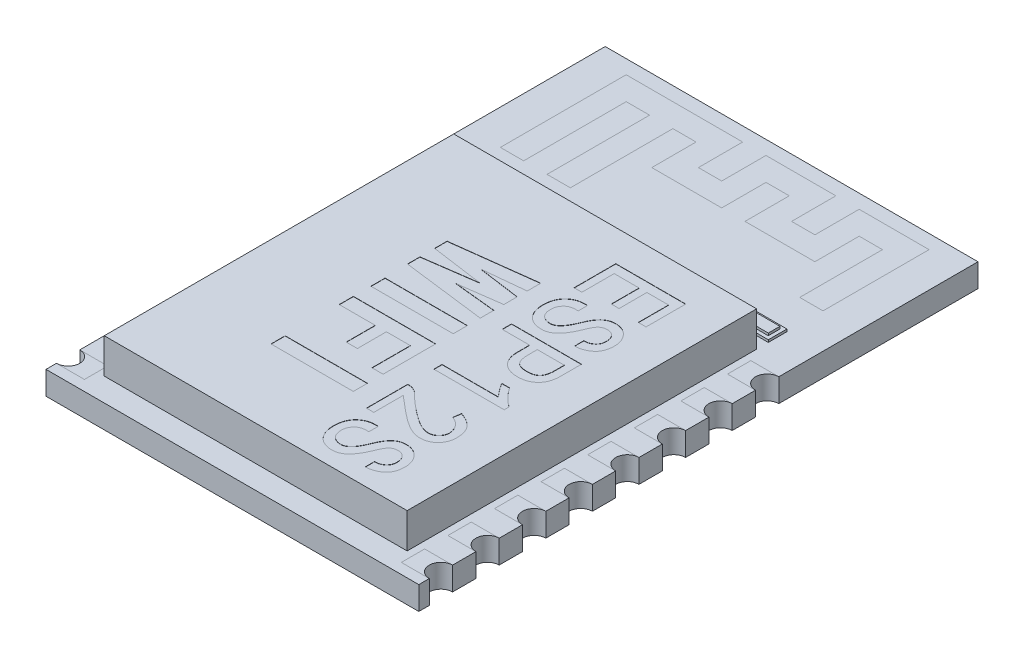
from build123d import *

# Parameters (mm, degrees)
SKETCH_1_W                = 16
SKETCH_1_H                = 24
EXTRUDE_1_DEPTH           = 1
SKETCH_2_W                = 13
SKETCH_2_H                = 15
EXTRUDE_2_DEPTH           = 1.5
CUT_EXTRUDE_1_DEPTH       = 1
SKETCH_9_W                = 1.6
SKETCH_9_H                = 0.8
EXTRUDE_3_DEPTH           = 0.1
SKETCH_10_W               = 1.3
SKETCH_10_H               = 0.5
EXTRUDE_4_DEPTH           = 0.1
CUT_EXTRUDE_START         = -0.01
CUT_EXTRUDE_2_OUTLINE_W   = 3.531838856
CUT_EXTRUDE_2_OUTLINE_H   = 0.607212475
CUT_EXTRUDE_2_OUTLINE_H_2 = 0.607212476
CUT_EXTRUDE_2_DEPTH       = 0.01
SKETCH_8_W                = 3.2
SKETCH_8_H                = 3.2
CUT_EXTRUDE_5_DEPTH       = 0.01


# Read off the part's stored shape, not the designer's step: 切除-拉伸2
with BuildPart() as part:
    # 草图1 → 凸台-拉伸1 (new body)
    with BuildSketch(Plane(origin=(0, 0, 0), x_dir=(1, 0, 0), z_dir=(0, 1, 0))):
        Rectangle(SKETCH_1_W, SKETCH_1_H)
    extrude(amount=EXTRUDE_1_DEPTH)

    # 草图2 → 凸台-拉伸2 (add)
    with BuildSketch(Plane(origin=(0, 1, 0), x_dir=(1, 0, 0), z_dir=(0, 1, 0))):
        with Locations((0, -3.5)):
            Rectangle(SKETCH_2_W, SKETCH_2_H)
    extrude(amount=EXTRUDE_2_DEPTH)

    # 草图3 → 切除-拉伸1 (cut)
    with BuildSketch(Plane(origin=(0, 1, 0), x_dir=(1, 0, 0), z_dir=(0, 1, 0))):
        with BuildLine():
            ThreePointArc((-8, 3.45), (-8.5, 2.95), (-8, 2.45))
            Line((-8, 2.45), (-8, 3.45))
        make_face()
        with BuildLine():
            Line((-8, 3.45), (-8, 2.45))
            ThreePointArc((-8, 2.45), (-7.646446609, 2.596446609), (-7.5, 2.95))
            ThreePointArc((-7.5, 2.95), (-7.646446609, 3.303553391), (-8, 3.45))
        make_face()
        with BuildLine():
            ThreePointArc((-8, 1.45), (-8.5, 0.95), (-8, 0.45))
            Line((-8, 0.45), (-8, 1.45))
        make_face()
        with BuildLine():
            Line((-8, 1.45), (-8, 0.45))
            ThreePointArc((-8, 0.45), (-7.646446609, 0.596446609), (-7.5, 0.95))
            ThreePointArc((-7.5, 0.95), (-7.646446609, 1.303553391), (-8, 1.45))
        make_face()
        with BuildLine():
            ThreePointArc((-8, -0.55), (-8.5, -1.05), (-8, -1.55))
            Line((-8, -1.55), (-8, -0.55))
        make_face()
        with BuildLine():
            Line((-8, -0.55), (-8, -1.55))
            ThreePointArc((-8, -1.55), (-7.646446609, -1.403553391), (-7.5, -1.05))
            ThreePointArc((-7.5, -1.05), (-7.646446609, -0.696446609), (-8, -0.55))
        make_face()
        with BuildLine():
            ThreePointArc((-8, -2.55), (-8.5, -3.05), (-8, -3.55))
            Line((-8, -3.55), (-8, -2.55))
        make_face()
        with BuildLine():
            Line((-8, -2.55), (-8, -3.55))
            ThreePointArc((-8, -3.55), (-7.646446609, -3.403553391), (-7.5, -3.05))
            ThreePointArc((-7.5, -3.05), (-7.646446609, -2.696446609), (-8, -2.55))
        make_face()
        with BuildLine():
            ThreePointArc((-8, -4.55), (-8.5, -5.05), (-8, -5.55))
            Line((-8, -5.55), (-8, -4.55))
        make_face()
        with BuildLine():
            Line((-8, -4.55), (-8, -5.55))
            ThreePointArc((-8, -5.55), (-7.646446609, -5.403553391), (-7.5, -5.05))
            ThreePointArc((-7.5, -5.05), (-7.646446609, -4.696446609), (-8, -4.55))
        make_face()
        with BuildLine():
            ThreePointArc((-8, -6.55), (-8.5, -7.05), (-8, -7.55))
            Line((-8, -7.55), (-8, -6.55))
        make_face()
        with BuildLine():
            Line((-8, -6.55), (-8, -7.55))
            ThreePointArc((-8, -7.55), (-7.646446609, -7.403553391), (-7.5, -7.05))
            ThreePointArc((-7.5, -7.05), (-7.646446609, -6.696446609), (-8, -6.55))
        make_face()
        with BuildLine():
            ThreePointArc((-8, -8.55), (-8.5, -9.05), (-8, -9.55))
            Line((-8, -9.55), (-8, -8.55))
        make_face()
        with BuildLine():
            Line((-8, -8.55), (-8, -9.55))
            ThreePointArc((-8, -9.55), (-7.646446609, -9.403553391), (-7.5, -9.05))
            ThreePointArc((-7.5, -9.05), (-7.646446609, -8.696446609), (-8, -8.55))
        make_face()
        with BuildLine():
            Line((-8, -10.55), (-8, -11.55))
            ThreePointArc((-8, -11.55), (-7.646446609, -11.403553391), (-7.5, -11.05))
            ThreePointArc((-7.5, -11.05), (-7.646446609, -10.696446609), (-8, -10.55))
        make_face()
        with BuildLine():
            ThreePointArc((-8, -10.55), (-8.5, -11.05), (-8, -11.55))
            Line((-8, -11.55), (-8, -10.55))
        make_face()
        with BuildLine():
            Line((8, -10.55), (8, -11.55))
            ThreePointArc((8, -11.55), (8.353553391, -11.403553391), (8.5, -11.05))
            ThreePointArc((8.5, -11.05), (8.353553391, -10.696446609), (8, -10.55))
        make_face()
        with BuildLine():
            ThreePointArc((8, -10.55), (7.5, -11.05), (8, -11.55))
            Line((8, -11.55), (8, -10.55))
        make_face()
        with BuildLine():
            ThreePointArc((8, -8.55), (7.5, -9.05), (8, -9.55))
            Line((8, -9.55), (8, -8.55))
        make_face()
        with BuildLine():
            Line((8, -8.55), (8, -9.55))
            ThreePointArc((8, -9.55), (8.353553391, -9.403553391), (8.5, -9.05))
            ThreePointArc((8.5, -9.05), (8.353553391, -8.696446609), (8, -8.55))
        make_face()
        with BuildLine():
            ThreePointArc((8, -6.55), (7.5, -7.05), (8, -7.55))
            Line((8, -7.55), (8, -6.55))
        make_face()
        with BuildLine():
            Line((8, -6.55), (8, -7.55))
            ThreePointArc((8, -7.55), (8.353553391, -7.403553391), (8.5, -7.05))
            ThreePointArc((8.5, -7.05), (8.353553391, -6.696446609), (8, -6.55))
        make_face()
        with BuildLine():
            ThreePointArc((8, -4.55), (7.5, -5.05), (8, -5.55))
            Line((8, -5.55), (8, -4.55))
        make_face()
        with BuildLine():
            Line((8, -4.55), (8, -5.55))
            ThreePointArc((8, -5.55), (8.353553391, -5.403553391), (8.5, -5.05))
            ThreePointArc((8.5, -5.05), (8.353553391, -4.696446609), (8, -4.55))
        make_face()
        with BuildLine():
            ThreePointArc((8, -2.55), (7.5, -3.05), (8, -3.55))
            Line((8, -3.55), (8, -2.55))
        make_face()
        with BuildLine():
            Line((8, -2.55), (8, -3.55))
            ThreePointArc((8, -3.55), (8.353553391, -3.403553391), (8.5, -3.05))
            ThreePointArc((8.5, -3.05), (8.353553391, -2.696446609), (8, -2.55))
        make_face()
        with BuildLine():
            ThreePointArc((8, -0.55), (7.5, -1.05), (8, -1.55))
            Line((8, -1.55), (8, -0.55))
        make_face()
        with BuildLine():
            Line((8, -0.55), (8, -1.55))
            ThreePointArc((8, -1.55), (8.353553391, -1.403553391), (8.5, -1.05))
            ThreePointArc((8.5, -1.05), (8.353553391, -0.696446609), (8, -0.55))
        make_face()
        with BuildLine():
            ThreePointArc((8, 1.45), (7.5, 0.95), (8, 0.45))
            Line((8, 0.45), (8, 1.45))
        make_face()
        with BuildLine():
            Line((8, 1.45), (8, 0.45))
            ThreePointArc((8, 0.45), (8.353553391, 0.596446609), (8.5, 0.95))
            ThreePointArc((8.5, 0.95), (8.353553391, 1.303553391), (8, 1.45))
        make_face()
        with BuildLine():
            ThreePointArc((8, 3.45), (7.5, 2.95), (8, 2.45))
            Line((8, 2.45), (8, 3.45))
        make_face()
        with BuildLine():
            Line((8, 3.45), (8, 2.45))
            ThreePointArc((8, 2.45), (8.353553391, 2.596446609), (8.5, 2.95))
            ThreePointArc((8.5, 2.95), (8.353553391, 3.303553391), (8, 3.45))
        make_face()
    extrude(amount=-CUT_EXTRUDE_1_DEPTH, mode=Mode.SUBTRACT)

    # 草图9 → 凸台-拉伸3 (add)
    with BuildSketch(Plane(origin=(0, 1, 0), x_dir=(1, 0, 0), z_dir=(0, 1, 0))):
        with Locations((5.7, 4.9)):
            Rectangle(SKETCH_9_W, SKETCH_9_H)
    extrude(amount=EXTRUDE_3_DEPTH)

    # 草图10 → 凸台-拉伸4 (add)
    with BuildSketch(Plane(origin=(0, 1.1, 0), x_dir=(1, 0, 0), z_dir=(0, 1, 0))):
        with Locations((5.7, 4.9)):
            Rectangle(SKETCH_10_W, SKETCH_10_H)
    extrude(amount=EXTRUDE_4_DEPTH)

    # 切除-拉伸2 outline → 切除-拉伸2 (cut)
    # profile 1 of 10: a face of its own
    with BuildSketch(Plane(origin=(0, 2.5, 0), x_dir=(1, 0, 0), z_dir=(0, 1, 0)).offset(CUT_EXTRUDE_START)):
        with BuildLine():
            add(Edge.make_bspline(
                [(3.519363514, -0.573077613), (3.506180189, -0.604374603), (3.480321871, -0.665761813), (3.438065941, -0.754342565), (3.393477309, -0.837105399), (3.346888787, -0.914390898), (3.2992323, -0.986513696), (3.248925337, -1.052982289), (3.197137753, -1.114210667), (3.143128362, -1.169656382), (3.087327215, -1.218956612), (3.030085251, -1.262684809), (2.969712111, -1.298137991), (2.908286481, -1.328486201), (2.844280267, -1.351193456), (2.778932691, -1.368309054), (2.711135379, -1.378266097), (2.665377652, -1.379479666), (2.642170532, -1.380095157)],
                knots=[0, 0, 0, 0, 0.08039145, 0.157683112, 0.232246008, 0.302860745, 0.37126645, 0.436798221, 0.500091035, 0.561008802, 0.619858574, 0.676262796, 0.73122448, 0.785347374, 0.838224428, 0.891702223, 0.945074206, 1, 1, 1, 1], degree=3))
            add(Edge.make_bspline(
                [(4.063223163, 0.023413615), (4.037768104, 0.022396868), (3.987900685, 0.020405023), (3.915815291, 0.001507672), (3.849482488, -0.029464233), (3.798207898, -0.065289123), (3.758940458, -0.103370017), (3.729141298, -0.142889003), (3.697369984, -0.191127277), (3.664016743, -0.248762656), (3.630282743, -0.316438497), (3.59345619, -0.392965264), (3.556858097, -0.479816814), (3.53226566, -0.540985927), (3.519363514, -0.573077613)],
                knots=[0, 0, 0, 0, 0.087880545, 0.172161291, 0.255589258, 0.339949821, 0.387083158, 0.444162172, 0.51062919, 0.586800429, 0.674217052, 0.772034265, 0.880400347, 1, 1, 1, 1], degree=3))
            add(Edge.make_bspline(
                [(4.484275795, -0.432726736), (4.483074162, -0.399237078), (4.480783329, -0.335391269), (4.458815205, -0.245038996), (4.423046912, -0.165363803), (4.372345628, -0.097879575), (4.310256118, -0.042998439), (4.236663872, -0.00379167), (4.152959017, 0.019252706), (4.093911407, 0.02199065), (4.063223163, 0.023413615)],
                knots=[0, 0, 0, 0, 0.143194835, 0.272991443, 0.395421471, 0.51469472, 0.631696167, 0.747467017, 0.868753474, 1, 1, 1, 1], degree=3))
            add(Edge.make_bspline(
                [(3.975503865, -0.888867087), (4.006972911, -0.890134244), (4.069172678, -0.892638828), (4.161013939, -0.874188051), (4.247874476, -0.838045884), (4.314849624, -0.794580554), (4.363848147, -0.752220585), (4.395871079, -0.715982307), (4.423515368, -0.676950205), (4.445556411, -0.634167461), (4.463336103, -0.588509062), (4.475587773, -0.539393376), (4.482709858, -0.487084377), (4.483744786, -0.451159418), (4.484275795, -0.432726736)],
                knots=[0, 0, 0, 0, 0.121689023, 0.240522989, 0.35943694, 0.484440651, 0.548073235, 0.609892423, 0.671357409, 0.732919718, 0.795884691, 0.860815642, 0.928586112, 1, 1, 1, 1], degree=3))
            Line((3.975503865, -0.888867087), (3.975503865, -1.292375859))
            add(Edge.make_bspline(
                [(4.835152988, -0.432726736), (4.83420401, -0.469361543), (4.832362195, -0.540463843), (4.820373567, -0.643266294), (4.799042758, -0.738043744), (4.768938228, -0.824795289), (4.730848953, -0.903892889), (4.683510498, -0.974861907), (4.627867106, -1.037953658), (4.56384263, -1.092111052), (4.495270717, -1.13851103), (4.425466025, -1.180158489), (4.35386765, -1.214561079), (4.280771224, -1.242566029), (4.20647261, -1.264660722), (4.130780353, -1.281384565), (4.053474262, -1.290265151), (4.001514457, -1.291671736), (3.975503865, -1.292375859)],
                knots=[0, 0, 0, 0, 0.08012593, 0.155511614, 0.225956229, 0.292174286, 0.355944404, 0.417432115, 0.478172602, 0.539316293, 0.600285405, 0.659105832, 0.716947181, 0.773778772, 0.830132553, 0.886344794, 0.943105267, 1, 1, 1, 1], degree=3))
            add(Edge.make_bspline(
                [(4.010591584, 0.426922387), (4.0405166, 0.426184203), (4.099303183, 0.424734067), (4.185384859, 0.413012085), (4.267002061, 0.392763641), (4.344196284, 0.364813141), (4.416855256, 0.328644988), (4.485599838, 0.285084977), (4.549408202, 0.232637116), (4.608046419, 0.173090995), (4.66098635, 0.108249241), (4.707995941, 0.040279937), (4.747326696, -0.031167629), (4.779072309, -0.105729083), (4.804856413, -0.182961256), (4.821886921, -0.263648756), (4.833739709, -0.347037452), (4.834677164, -0.403876792), (4.835152988, -0.432726736)],
                knots=[0, 0, 0, 0, 0.067427038, 0.132457913, 0.195323898, 0.256629766, 0.317100117, 0.377900567, 0.439653724, 0.502820319, 0.565947293, 0.628094699, 0.688830449, 0.749401199, 0.810529963, 0.872000797, 0.935031444, 1, 1, 1, 1], degree=3))
            add(Edge.make_bspline(
                [(3.203574041, -0.362551297), (3.216788134, -0.328676167), (3.242446937, -0.262898269), (3.283364792, -0.168499465), (3.325327106, -0.081399778), (3.368852054, -0.002100859), (3.413283181, 0.069922258), (3.458335789, 0.134978021), (3.505110172, 0.192290349), (3.553202841, 0.242402877), (3.602464664, 0.286280413), (3.654483596, 0.323596015), (3.708312446, 0.355568137), (3.764475938, 0.381660344), (3.822770169, 0.402131719), (3.883395983, 0.415985008), (3.946158659, 0.425870936), (3.988892463, 0.426568289), (4.010591584, 0.426922387)],
                knots=[0, 0, 0, 0, 0.090183126, 0.175115385, 0.255125584, 0.329900034, 0.399374445, 0.464950898, 0.526033913, 0.582646639, 0.63707613, 0.689410608, 0.741190679, 0.792144824, 0.842775086, 0.894115754, 0.946234715, 1, 1, 1, 1], degree=3))
            add(Edge.make_bspline(
                [(2.607082813, -0.976586385), (2.621623937, -0.976048673), (2.650447273, -0.974982825), (2.693416499, -0.967528691), (2.735575117, -0.955324014), (2.776615934, -0.937497372), (2.816825352, -0.914998716), (2.856196958, -0.887808291), (2.894869231, -0.855596098), (2.946257705, -0.804752533), (3.008177165, -0.728753163), (3.078286581, -0.623054519), (3.1445013, -0.499480753), (3.183253399, -0.409654146), (3.203574041, -0.362551297)],
                knots=[0, 0, 0, 0, 0.048187601, 0.095517193, 0.144136071, 0.193345056, 0.243482742, 0.296653913, 0.351715714, 0.410098816, 0.536033279, 0.675815952, 0.830005912, 1, 1, 1, 1], degree=3))
            add(Edge.make_bspline(
                [(2.098310883, -0.432726736), (2.098914015, -0.455263171), (2.100088012, -0.499130365), (2.106141498, -0.562690331), (2.117963177, -0.621615197), (2.134201031, -0.675801407), (2.154573642, -0.725710751), (2.181377854, -0.770005086), (2.210783366, -0.811066587), (2.25798062, -0.857049133), (2.323746141, -0.904858402), (2.411479889, -0.946246154), (2.506877277, -0.971974292), (2.573130702, -0.975023694), (2.607082813, -0.976586385)],
                knots=[0, 0, 0, 0, 0.080168459, 0.156047983, 0.226746188, 0.293516715, 0.357035717, 0.417804984, 0.477271478, 0.53609594, 0.651342444, 0.764702064, 0.879419644, 1, 1, 1, 1], degree=3))
            add(Edge.make_bspline(
                [(2.642170532, 0.093589054), (2.62092716, 0.093045997), (2.579400624, 0.091984431), (2.519090513, 0.085026373), (2.462486377, 0.07259888), (2.409995852, 0.055171921), (2.361095022, 0.032865182), (2.316277907, 0.005465389), (2.274791555, -0.026506168), (2.226197252, -0.075676788), (2.175956493, -0.144319644), (2.130226739, -0.23396059), (2.103653, -0.331386785), (2.100111688, -0.398565459), (2.098310883, -0.432726736)],
                knots=[0, 0, 0, 0, 0.074994762, 0.146599737, 0.213942401, 0.279226462, 0.341494568, 0.403258318, 0.464284066, 0.525919897, 0.646731649, 0.762993521, 0.879478952, 1, 1, 1, 1], degree=3))
            Line((2.642170532, 0.093589054), (2.74743369, 0.093589054))
            Line((2.74743369, 0.093589054), (2.74743369, 0.497097826))
            Line((2.74743369, 0.497097826), (2.624626672, 0.497097826))
            add(Edge.make_bspline(
                [(1.764977549, -0.432726736), (1.765667524, -0.397168016), (1.767013552, -0.327798736), (1.779155458, -0.227020379), (1.797481628, -0.13177459), (1.825023121, -0.04292388), (1.859142723, 0.040375099), (1.902205466, 0.11680097), (1.951166043, 0.188496311), (2.009596161, 0.252032295), (2.07200222, 0.310301784), (2.140222735, 0.35945577), (2.211400044, 0.4021233), (2.286273833, 0.437592678), (2.365517332, 0.464210559), (2.44851034, 0.482784827), (2.535246834, 0.495010915), (2.594478238, 0.496393896), (2.624626672, 0.497097826)],
                knots=[0, 0, 0, 0, 0.074780336, 0.145884277, 0.213265328, 0.278560235, 0.341267833, 0.402256536, 0.462806176, 0.523467163, 0.583453506, 0.642148692, 0.699977861, 0.757869831, 0.816085487, 0.875445506, 0.9366025, 1, 1, 1, 1], degree=3))
            add(Edge.make_bspline(
                [(2.642170532, -1.380095157), (2.609430742, -1.379373735), (2.545465698, -1.377964264), (2.451863569, -1.36614092), (2.3634858, -1.346146102), (2.280291672, -1.318071943), (2.202436466, -1.282251348), (2.129852114, -1.238192836), (2.061741837, -1.186989175), (2.000382243, -1.126901586), (1.944693979, -1.060527731), (1.896875132, -0.987425807), (1.855396055, -0.909098809), (1.822479694, -0.824598891), (1.796349374, -0.734829884), (1.778433573, -0.639065623), (1.767231896, -0.537823368), (1.765740129, -0.468277861), (1.764977549, -0.432726736)],
                knots=[0, 0, 0, 0, 0.067252245, 0.131393415, 0.193469626, 0.253139889, 0.311480996, 0.369180372, 0.42730211, 0.486155265, 0.545243512, 0.604983434, 0.665299085, 0.727031373, 0.790973074, 0.857131231, 0.926966592, 1, 1, 1, 1], degree=3))
        make_face()
    # profile 2 of 10: a face of its own
    with BuildSketch(Plane(origin=(0, 2.5, 0), x_dir=(1, 0, 0), z_dir=(0, 1, 0)).offset(CUT_EXTRUDE_START)):
        with BuildLine():
            add(Edge.make_bspline(
                [(4.800065269, -2.73097235), (4.799367841, -2.766528621), (4.798007272, -2.835893125), (4.785968512, -2.936705363), (4.76728999, -3.031769768), (4.741040249, -3.121066421), (4.705686968, -3.2038978), (4.662915105, -3.280538464), (4.61381515, -3.352142854), (4.555398386, -3.41614021), (4.491564848, -3.474158346), (4.421158464, -3.523627853), (4.346110107, -3.566458795), (4.264817712, -3.600649361), (4.178379382, -3.628315762), (4.086128244, -3.646500792), (3.988830257, -3.658787665), (3.922046516, -3.660115628), (3.887784567, -3.660796911)],
                knots=[0, 0, 0, 0, 0.072237185, 0.140923003, 0.20601254, 0.268959269, 0.329705172, 0.388619754, 0.447110204, 0.505708216, 0.564306227, 0.622076726, 0.680223313, 0.739581847, 0.80097498, 0.864338945, 0.930402039, 1, 1, 1, 1], degree=3))
            Line((4.800065269, -2.73097235), (4.800065269, -1.818691648))
            Line((4.800065269, -1.818691648), (1.800065269, -1.818691648))
            Line((1.800065269, -1.818691648), (1.800065269, -2.22220042))
            Line((1.800065269, -2.22220042), (2.975503865, -2.22220042))
            Line((2.975503865, -2.22220042), (2.975503865, -2.73097235))
            add(Edge.make_bspline(
                [(3.887784567, -3.660796911), (3.85352169, -3.660118347), (3.786736142, -3.658795681), (3.68945101, -3.646471128), (3.597356898, -3.628460418), (3.511079323, -3.600353772), (3.429594996, -3.566650306), (3.35442082, -3.523603409), (3.284000373, -3.47416544), (3.220176199, -3.416136554), (3.161736153, -3.352150324), (3.112719973, -3.280512209), (3.069672308, -3.204070821), (3.035548511, -3.120776158), (3.008008204, -3.031924227), (2.9896817, -2.936678784), (2.977539888, -2.835900329), (2.976193847, -2.766531062), (2.975503865, -2.73097235)],
                knots=[0, 0, 0, 0, 0.069601988, 0.135668906, 0.199036537, 0.2600136, 0.319780597, 0.377930548, 0.435704391, 0.494305794, 0.552907196, 0.611401032, 0.670319022, 0.730897548, 0.793975538, 0.859068842, 0.927758635, 1, 1, 1, 1], degree=3))
        make_face()
        with BuildLine():
            add(Edge.make_bspline(
                [(3.308837199, -2.625709192), (3.309192787, -2.651277138), (3.309880857, -2.700751528), (3.315675621, -2.772390826), (3.325630623, -2.838931815), (3.338067382, -2.901072024), (3.355772203, -2.95787333), (3.376338044, -3.010218724), (3.402094609, -3.056882602), (3.430434981, -3.099915749), (3.464772872, -3.138026207), (3.506454127, -3.169536371), (3.553731947, -3.19749198), (3.608260263, -3.219052878), (3.668907679, -3.236716787), (3.736201546, -3.248768955), (3.809878319, -3.255773026), (3.861127661, -3.256769718), (3.887784567, -3.257288139)],
                knots=[0, 0, 0, 0, 0.076925933, 0.14885293, 0.216041695, 0.279310719, 0.339299365, 0.394847344, 0.448211525, 0.499365108, 0.549647785, 0.601661776, 0.655984352, 0.71443825, 0.777549324, 0.845807357, 0.919798019, 1, 1, 1, 1], degree=3))
            Line((3.308837199, -2.625709192), (3.308837199, -2.22220042))
            Line((3.308837199, -2.22220042), (4.466731935, -2.22220042))
            Line((4.466731935, -2.22220042), (4.466731935, -2.625709192))
            add(Edge.make_bspline(
                [(3.887784567, -3.257288139), (3.914441473, -3.256769718), (3.965690815, -3.255773026), (4.039367588, -3.248768955), (4.106661455, -3.236716787), (4.167308871, -3.219052878), (4.221837187, -3.19749198), (4.269115007, -3.169536371), (4.310796262, -3.138026207), (4.345134153, -3.099915749), (4.373474525, -3.056882602), (4.39923109, -3.010218724), (4.419796931, -2.95787333), (4.437501752, -2.901072024), (4.449938511, -2.838931815), (4.459893513, -2.772390826), (4.465688277, -2.700751528), (4.466376347, -2.651277138), (4.466731935, -2.625709192)],
                knots=[0, 0, 0, 0, 0.080201981, 0.154192643, 0.222450676, 0.28556175, 0.344015648, 0.398338224, 0.450352215, 0.500634892, 0.551788475, 0.605152656, 0.660700635, 0.720689281, 0.783958305, 0.85114707, 0.923074067, 1, 1, 1, 1], degree=3))
        make_face(mode=Mode.SUBTRACT)
    # profile 3 of 10: a face of its own
    with BuildSketch(Plane(origin=(0, 2.5, 0), x_dir=(1, 0, 0), z_dir=(0, 1, 0)).offset(CUT_EXTRUDE_START)):
        with BuildLine():
            add(Edge.make_bspline(
                [(4.23866176, -4.818691648), (4.200341417, -4.778749928), (4.12137057, -4.696437736), (4.011641474, -4.557987256), (3.902809968, -4.405388083), (3.834976499, -4.296027757), (3.800065269, -4.23974428)],
                knots=[0, 0, 0, 0, 0.227981698, 0.469826365, 0.72714039, 1, 1, 1, 1], degree=3))
            Line((4.23866176, -4.818691648), (1.817609128, -4.818691648))
            Line((1.817609128, -4.818691648), (1.817609128, -5.169568841))
            Line((1.817609128, -5.169568841), (4.835152988, -5.169568841))
            Line((4.835152988, -5.169568841), (4.835152988, -4.959042525))
            add(Edge.make_bspline(
                [(4.133398602, -4.23974428), (4.158353766, -4.275766777), (4.207915207, -4.347308159), (4.288526497, -4.448829282), (4.370606056, -4.546980221), (4.457506414, -4.638792925), (4.546265119, -4.727187046), (4.639369539, -4.809234727), (4.735032348, -4.887371157), (4.801751069, -4.935131759), (4.835152988, -4.959042525)],
                knots=[0, 0, 0, 0, 0.130065823, 0.25831326, 0.384694891, 0.509800671, 0.63347879, 0.756459557, 0.878074431, 1, 1, 1, 1], degree=3))
            Line((4.133398602, -4.23974428), (3.800065269, -4.23974428))
        make_face()
    # profile 4 of 10: a face of its own
    with BuildSketch(Plane(origin=(0, 2.5, 0), x_dir=(1, 0, 0), z_dir=(0, 1, 0)).offset(CUT_EXTRUDE_START)):
        with BuildLine():
            add(Edge.make_bspline(
                [(1.887784567, -6.292375859), (1.909515632, -6.294498104), (1.952707223, -6.298716174), (2.016247691, -6.313527569), (2.078285712, -6.33436829), (2.138793474, -6.361786629), (2.1977955, -6.395641247), (2.25404259, -6.437283266), (2.31001382, -6.483783926), (2.362916324, -6.539394678), (2.419204662, -6.599355424), (2.483633671, -6.661461861), (2.553974533, -6.728731762), (2.633224949, -6.798439383), (2.718534912, -6.873528123), (2.812425502, -6.951108955), (2.913099021, -7.033037752), (3.0186915, -7.117003623), (3.124722655, -7.199322402), (3.22756333, -7.27506172), (3.323222604, -7.344267637), (3.413391785, -7.404781638), (3.496807972, -7.458236333), (3.574357468, -7.503637283), (3.644743584, -7.542569001), (3.728855943, -7.581360113), (3.825845158, -7.617957003), (3.936036117, -7.646771018), (4.03799384, -7.659495445), (4.131717491, -7.655420171), (4.2174141, -7.635241194), (4.294656131, -7.599141243), (4.364774439, -7.549940896), (4.424396298, -7.486731186), (4.47351955, -7.414774226), (4.506513599, -7.334672765), (4.523160191, -7.249189971), (4.521681958, -7.15973925), (4.505478676, -7.069419296), (4.477991706, -6.979220251), (4.434262271, -6.892624538), (4.38032354, -6.807690646), (4.311234534, -6.728313236), (4.225380311, -6.659095847), (4.124183461, -6.600155873), (4.049388207, -6.57077417), (4.010591584, -6.555533753)],
                knots=[0, 0, 0, 0, 0.015528403, 0.030863488, 0.046319007, 0.062051955, 0.078077562, 0.094638595, 0.111813351, 0.129802023, 0.149212527, 0.17036358, 0.193485128, 0.218490961, 0.245482667, 0.2743827, 0.305180101, 0.337878908, 0.370413736, 0.40072568, 0.428792837, 0.454449914, 0.478016956, 0.499303003, 0.518412359, 0.535243194, 0.565198182, 0.592084442, 0.61614262, 0.63806247, 0.658517644, 0.678385071, 0.69840506, 0.719123498, 0.739905514, 0.760091049, 0.780350051, 0.801472988, 0.823372766, 0.845511126, 0.868334666, 0.892197902, 0.91699947, 0.942860949, 0.970361726, 1, 1, 1, 1], degree=3))
            Line((1.887784567, -6.292375859), (1.817609128, -6.292375859))
            Line((1.817609128, -6.292375859), (1.817609128, -8.064305683))
            Line((1.817609128, -8.064305683), (2.133398602, -8.064305683))
            Line((2.133398602, -8.064305683), (2.133398602, -6.801147788))
            add(Edge.make_bspline(
                [(4.852696848, -7.099393403), (4.854991319, -7.127963189), (4.85943628, -7.183309966), (4.860255323, -7.264744547), (4.855007806, -7.341605028), (4.844865704, -7.415447193), (4.827049714, -7.487393824), (4.80054441, -7.559619902), (4.76527106, -7.632906682), (4.721630775, -7.706627009), (4.667778901, -7.778264838), (4.600881176, -7.84367444), (4.520959346, -7.901109244), (4.43142625, -7.953763091), (4.329571145, -7.994128042), (4.216955311, -8.019578977), (4.094552191, -8.028194007), (3.986460881, -8.024738989), (3.895245855, -8.011077332), (3.822316572, -7.99390993), (3.745897631, -7.970281985), (3.66616815, -7.9398282), (3.583510338, -7.901408941), (3.49706037, -7.857671186), (3.408086411, -7.805532046), (3.331230816, -7.75817811), (3.26723667, -7.715283969), (3.215017647, -7.679354829), (3.159275363, -7.640105598), (3.100900103, -7.596047517), (3.038537526, -7.549532714), (2.97279071, -7.49943206), (2.903861419, -7.445555493), (2.832157184, -7.387359291), (2.755516957, -7.327317817), (2.676791233, -7.262353368), (2.594772426, -7.19378528), (2.508793397, -7.122343101), (2.419477946, -7.047278585), (2.326938019, -6.968499446), (2.231582691, -6.885755437), (2.166553725, -6.829718375), (2.133398602, -6.801147788)],
                knots=[0, 0, 0, 0, 0.023105011, 0.044760148, 0.065588326, 0.085172878, 0.104783108, 0.12522332, 0.147094257, 0.170275039, 0.194200332, 0.21914529, 0.245376235, 0.273383393, 0.30269878, 0.333327751, 0.366088924, 0.401392347, 0.420285778, 0.440364722, 0.461742054, 0.484736589, 0.509118316, 0.535204113, 0.562821461, 0.592235509, 0.607976672, 0.624930423, 0.643343185, 0.662937078, 0.683892981, 0.706071999, 0.729582622, 0.754428356, 0.780528762, 0.808076455, 0.83671885, 0.86672517, 0.898207495, 0.93078711, 0.964711697, 1, 1, 1, 1], degree=3))
            add(Edge.make_bspline(
                [(4.063223163, -6.22220042), (4.095852234, -6.233970355), (4.159334229, -6.256869534), (4.249742682, -6.296280018), (4.333852536, -6.337069062), (4.411432305, -6.380071252), (4.481050785, -6.427363582), (4.544267781, -6.476099149), (4.601566865, -6.526580436), (4.650779009, -6.581054344), (4.694770981, -6.637228865), (4.733260347, -6.695907926), (4.766345813, -6.757057195), (4.794641354, -6.820613681), (4.81740805, -6.886682736), (4.83397353, -6.955523875), (4.846822401, -7.02644225), (4.850721939, -7.074868216), (4.852696848, -7.099393403)],
                knots=[0, 0, 0, 0, 0.082427207, 0.160367536, 0.234274345, 0.304579128, 0.370973421, 0.434095708, 0.494249014, 0.552184953, 0.608308492, 0.663709605, 0.718765207, 0.773388273, 0.828904078, 0.884591478, 0.941551696, 1, 1, 1, 1], degree=3))
            Line((4.063223163, -6.22220042), (4.010591584, -6.555533753))
        make_face()
    # profile 5 of 10: a face of its own
    with BuildSketch(Plane(origin=(0, 2.5, 0), x_dir=(1, 0, 0), z_dir=(0, 1, 0)).offset(CUT_EXTRUDE_START)):
        with BuildLine():
            add(Edge.make_bspline(
                [(3.519363514, -9.555533753), (3.506180189, -9.586830743), (3.480321871, -9.648217953), (3.438065941, -9.736798705), (3.393477309, -9.81956154), (3.346888787, -9.896847038), (3.2992323, -9.968969837), (3.248925337, -10.03543843), (3.197137753, -10.096666807), (3.143128362, -10.152112522), (3.087327215, -10.201412753), (3.030085251, -10.245140949), (2.969712111, -10.280594131), (2.908286481, -10.310942341), (2.844280267, -10.333649596), (2.778932691, -10.350765194), (2.711135379, -10.360722237), (2.665377652, -10.361935807), (2.642170532, -10.362551297)],
                knots=[0, 0, 0, 0, 0.08039145, 0.157683112, 0.232246008, 0.302860745, 0.37126645, 0.436798221, 0.500091035, 0.561008802, 0.619858574, 0.676262796, 0.73122448, 0.785347374, 0.838224428, 0.891702223, 0.945074206, 1, 1, 1, 1], degree=3))
            add(Edge.make_bspline(
                [(4.063223163, -8.959042525), (4.037768104, -8.960059272), (3.987900685, -8.962051117), (3.915815291, -8.980948469), (3.849482488, -9.011920373), (3.798207898, -9.047745263), (3.758940458, -9.085826158), (3.729141298, -9.125345143), (3.697369984, -9.173583418), (3.664016743, -9.231218796), (3.630282743, -9.298894637), (3.59345619, -9.375421405), (3.556858097, -9.462272954), (3.53226566, -9.523442068), (3.519363514, -9.555533753)],
                knots=[0, 0, 0, 0, 0.087880545, 0.172161291, 0.255589258, 0.339949821, 0.387083158, 0.444162172, 0.51062919, 0.586800429, 0.674217052, 0.772034265, 0.880400347, 1, 1, 1, 1], degree=3))
            add(Edge.make_bspline(
                [(4.484275795, -9.415182876), (4.483074162, -9.381693218), (4.480783329, -9.317847409), (4.458815205, -9.227495136), (4.423046912, -9.147819944), (4.372345628, -9.080335716), (4.310256118, -9.02545458), (4.236663872, -8.986247811), (4.152959017, -8.963203434), (4.093911407, -8.96046549), (4.063223163, -8.959042525)],
                knots=[0, 0, 0, 0, 0.143194835, 0.272991443, 0.395421471, 0.51469472, 0.631696167, 0.747467017, 0.868753474, 1, 1, 1, 1], degree=3))
            add(Edge.make_bspline(
                [(3.975503865, -9.871323227), (4.006972911, -9.872590384), (4.069172678, -9.875094968), (4.161013939, -9.856644191), (4.247874476, -9.820502024), (4.314849624, -9.777036694), (4.363848147, -9.734676726), (4.395871079, -9.698438447), (4.423515368, -9.659406345), (4.445556411, -9.616623601), (4.463336103, -9.570965203), (4.475587773, -9.521849516), (4.482709858, -9.469540518), (4.483744786, -9.433615558), (4.484275795, -9.415182876)],
                knots=[0, 0, 0, 0, 0.121689023, 0.240522989, 0.35943694, 0.484440651, 0.548073235, 0.609892423, 0.671357409, 0.732919718, 0.795884691, 0.860815642, 0.928586112, 1, 1, 1, 1], degree=3))
            Line((3.975503865, -9.871323227), (3.975503865, -10.274831999))
            add(Edge.make_bspline(
                [(4.835152988, -9.415182876), (4.83420401, -9.451817683), (4.832362195, -9.522919983), (4.820373567, -9.625722434), (4.799042758, -9.720499885), (4.768938228, -9.80725143), (4.730848953, -9.88634903), (4.683510498, -9.957318047), (4.627867106, -10.020409799), (4.56384263, -10.074567192), (4.495270717, -10.12096717), (4.425466025, -10.162614629), (4.35386765, -10.197017219), (4.280771224, -10.22502217), (4.20647261, -10.247116863), (4.130780353, -10.263840705), (4.053474262, -10.272721291), (4.001514457, -10.274127876), (3.975503865, -10.274831999)],
                knots=[0, 0, 0, 0, 0.08012593, 0.155511614, 0.225956229, 0.292174286, 0.355944404, 0.417432115, 0.478172602, 0.539316293, 0.600285405, 0.659105832, 0.716947181, 0.773778772, 0.830132553, 0.886344794, 0.943105267, 1, 1, 1, 1], degree=3))
            add(Edge.make_bspline(
                [(4.010591584, -8.555533753), (4.0405166, -8.556271938), (4.099303183, -8.557722073), (4.185384859, -8.569444056), (4.267002061, -8.5896925), (4.344196284, -8.617642999), (4.416855256, -8.653811152), (4.485599838, -8.697371164), (4.549408202, -8.749819024), (4.608046419, -8.809365146), (4.66098635, -8.8742069), (4.707995941, -8.942176204), (4.747326696, -9.013623769), (4.779072309, -9.088185223), (4.804856413, -9.165417397), (4.821886921, -9.246104897), (4.833739709, -9.329493593), (4.834677164, -9.386332932), (4.835152988, -9.415182876)],
                knots=[0, 0, 0, 0, 0.067427038, 0.132457913, 0.195323898, 0.256629766, 0.317100117, 0.377900567, 0.439653724, 0.502820319, 0.565947293, 0.628094699, 0.688830449, 0.749401199, 0.810529963, 0.872000797, 0.935031444, 1, 1, 1, 1], degree=3))
            add(Edge.make_bspline(
                [(3.203574041, -9.345007438), (3.216788134, -9.311132307), (3.242446937, -9.24535441), (3.283364792, -9.150955606), (3.325327106, -9.063855919), (3.368852054, -8.984557), (3.413283181, -8.912533882), (3.458335789, -8.847478119), (3.505110172, -8.790165792), (3.553202841, -8.740053264), (3.602464664, -8.696175728), (3.654483596, -8.658860125), (3.708312446, -8.626888003), (3.764475938, -8.600795796), (3.822770169, -8.580324421), (3.883395983, -8.566471132), (3.946158659, -8.556585205), (3.988892463, -8.555887851), (4.010591584, -8.555533753)],
                knots=[0, 0, 0, 0, 0.090183126, 0.175115385, 0.255125584, 0.329900034, 0.399374445, 0.464950898, 0.526033913, 0.582646639, 0.63707613, 0.689410608, 0.741190679, 0.792144824, 0.842775086, 0.894115754, 0.946234715, 1, 1, 1, 1], degree=3))
            add(Edge.make_bspline(
                [(2.607082813, -9.959042525), (2.621623937, -9.958504814), (2.650447273, -9.957438965), (2.693416499, -9.949984831), (2.735575117, -9.937780155), (2.776615934, -9.919953513), (2.816825352, -9.897454856), (2.856196958, -9.870264432), (2.894869231, -9.838052238), (2.946257705, -9.787208673), (3.008177165, -9.711209303), (3.078286581, -9.60551066), (3.1445013, -9.481936893), (3.183253399, -9.392110286), (3.203574041, -9.345007438)],
                knots=[0, 0, 0, 0, 0.048187601, 0.095517193, 0.144136071, 0.193345056, 0.243482742, 0.296653913, 0.351715714, 0.410098816, 0.536033279, 0.675815952, 0.830005912, 1, 1, 1, 1], degree=3))
            add(Edge.make_bspline(
                [(2.098310883, -9.415182876), (2.098914015, -9.437719312), (2.100088012, -9.481586505), (2.106141498, -9.545146472), (2.117963177, -9.604071338), (2.134201031, -9.658257547), (2.154573642, -9.708166892), (2.181377854, -9.752461226), (2.210783366, -9.793522727), (2.25798062, -9.839505273), (2.323746141, -9.887314542), (2.411479889, -9.928702295), (2.506877277, -9.954430432), (2.573130702, -9.957479834), (2.607082813, -9.959042525)],
                knots=[0, 0, 0, 0, 0.080168459, 0.156047983, 0.226746188, 0.293516715, 0.357035717, 0.417804984, 0.477271478, 0.53609594, 0.651342444, 0.764702064, 0.879419644, 1, 1, 1, 1], degree=3))
            add(Edge.make_bspline(
                [(2.642170532, -8.888867087), (2.62092716, -8.889410143), (2.579400624, -8.89047171), (2.519090513, -8.897429767), (2.462486377, -8.90985726), (2.409995852, -8.927284219), (2.361095022, -8.949590959), (2.316277907, -8.976990752), (2.274791555, -9.008962309), (2.226197252, -9.058132928), (2.175956493, -9.126775784), (2.130226739, -9.21641673), (2.103653, -9.313842926), (2.100111688, -9.381021599), (2.098310883, -9.415182876)],
                knots=[0, 0, 0, 0, 0.074994762, 0.146599737, 0.213942401, 0.279226462, 0.341494568, 0.403258318, 0.464284066, 0.525919897, 0.646731649, 0.762993521, 0.879478952, 1, 1, 1, 1], degree=3))
            Line((2.642170532, -8.888867087), (2.74743369, -8.888867087))
            Line((2.74743369, -8.888867087), (2.74743369, -8.485358315))
            Line((2.74743369, -8.485358315), (2.624626672, -8.485358315))
            add(Edge.make_bspline(
                [(1.764977549, -9.415182876), (1.765667524, -9.379624157), (1.767013552, -9.310254877), (1.779155458, -9.209476519), (1.797481628, -9.114230731), (1.825023121, -9.025380021), (1.859142723, -8.942081041), (1.902205466, -8.86565517), (1.951166043, -8.793959829), (2.009596161, -8.730423845), (2.07200222, -8.672154356), (2.140222735, -8.62300037), (2.211400044, -8.58033284), (2.286273833, -8.544863462), (2.365517332, -8.518245581), (2.44851034, -8.499671313), (2.535246834, -8.487445225), (2.594478238, -8.486062244), (2.624626672, -8.485358315)],
                knots=[0, 0, 0, 0, 0.074780336, 0.145884277, 0.213265328, 0.278560235, 0.341267833, 0.402256536, 0.462806176, 0.523467163, 0.583453506, 0.642148692, 0.699977861, 0.757869831, 0.816085487, 0.875445506, 0.9366025, 1, 1, 1, 1], degree=3))
            add(Edge.make_bspline(
                [(2.642170532, -10.362551297), (2.609430742, -10.361829875), (2.545465698, -10.360420404), (2.451863569, -10.34859706), (2.3634858, -10.328602242), (2.280291672, -10.300528083), (2.202436466, -10.264707488), (2.129852114, -10.220648976), (2.061741837, -10.169445316), (2.000382243, -10.109357726), (1.944693979, -10.042983871), (1.896875132, -9.969881948), (1.855396055, -9.89155495), (1.822479694, -9.807055032), (1.796349374, -9.717286024), (1.778433573, -9.621521763), (1.767231896, -9.520279508), (1.765740129, -9.450734001), (1.764977549, -9.415182876)],
                knots=[0, 0, 0, 0, 0.067252245, 0.131393415, 0.193469626, 0.253139889, 0.311480996, 0.369180372, 0.42730211, 0.486155265, 0.545243512, 0.604983434, 0.665299085, 0.727031373, 0.790973074, 0.857131231, 0.926966592, 1, 1, 1, 1], degree=3))
        make_face()
    # profile 6 of 10: a face of its own
    with BuildSketch(Plane(origin=(0, 2.5, 0), x_dir=(1, 0, 0), z_dir=(0, 1, 0)).offset(CUT_EXTRUDE_START)):
        Polygon((1.800065269, 0.865518878), (2.133398602, 0.865518878), (2.133398602, 2.25148379), (3.203574041, 2.25148379), (3.203574041, 1.058501334), (3.536907374, 1.058501334), (3.536907374, 2.25148379), (4.466731935, 2.25148379), (4.466731935, 0.953238176), (4.800065269, 0.953238176), (4.800065269, 2.654992562), (1.800065269, 2.654992562), align=None)
    # profile 7 of 10: a face of its own
    with BuildSketch(Plane(origin=(0, 2.5, 0), x_dir=(1, 0, 0), z_dir=(0, 1, 0)).offset(CUT_EXTRUDE_START)):
        Polygon((0.914612817, -2.277333886), (0.914612817, -1.694379587), (-0.883854574, -1.512540086), (0.914612817, -1.265313094), (0.914612817, -0.69145561), (-0.883854574, -0.44360588), (0.914612817, -0.262389117), (0.914612817, 0.319049046), (-2.657403644, -0.128211079), (-2.657403644, -0.662649026), (-0.412174659, -0.978384352), (-2.657403644, -1.294119678), (-2.657403644, -1.828557625), align=None)
    # profile 8 of 10: a face of its own
    with BuildSketch(Plane(origin=(0, 2.5, 0), x_dir=(1, 0, 0), z_dir=(0, 1, 0)).offset(CUT_EXTRUDE_START)):
        with Locations((-0.851306611, -3.13342009)):
            Rectangle(CUT_EXTRUDE_2_OUTLINE_W, CUT_EXTRUDE_2_OUTLINE_H)
    # profile 9 of 10: a face of its own
    with BuildSketch(Plane(origin=(0, 2.5, 0), x_dir=(1, 0, 0), z_dir=(0, 1, 0)).offset(CUT_EXTRUDE_START)):
        Polygon((0.914612817, -6.445646644), (0.914612817, -4.190394315), (-2.617226039, -4.190394315), (-2.617226039, -4.798364859), (-1.0707673, -4.798364859), (-1.0707673, -6.043870598), (-0.591668318, -6.043870598), (-0.591668318, -4.798364859), (0.436271903, -4.798364859), (0.436271903, -6.445646644), align=None)
    # profile 10 of 10: a face of its own
    with BuildSketch(Plane(origin=(0, 2.5, 0), x_dir=(1, 0, 0), z_dir=(0, 1, 0)).offset(CUT_EXTRUDE_START)):
        with Locations((-0.851306611, -7.42226566)):
            Rectangle(CUT_EXTRUDE_2_OUTLINE_W, CUT_EXTRUDE_2_OUTLINE_H_2)
    extrude(amount=CUT_EXTRUDE_2_DEPTH, mode=Mode.SUBTRACT)

    # 草图8 → 切除-拉伸5 (cut)
    with BuildSketch(Plane.XZ):
        with Locations((0.2, 1.2)):
            Rectangle(SKETCH_8_W, SKETCH_8_H)
    extrude(amount=-CUT_EXTRUDE_5_DEPTH, mode=Mode.SUBTRACT)


solid = part.part
